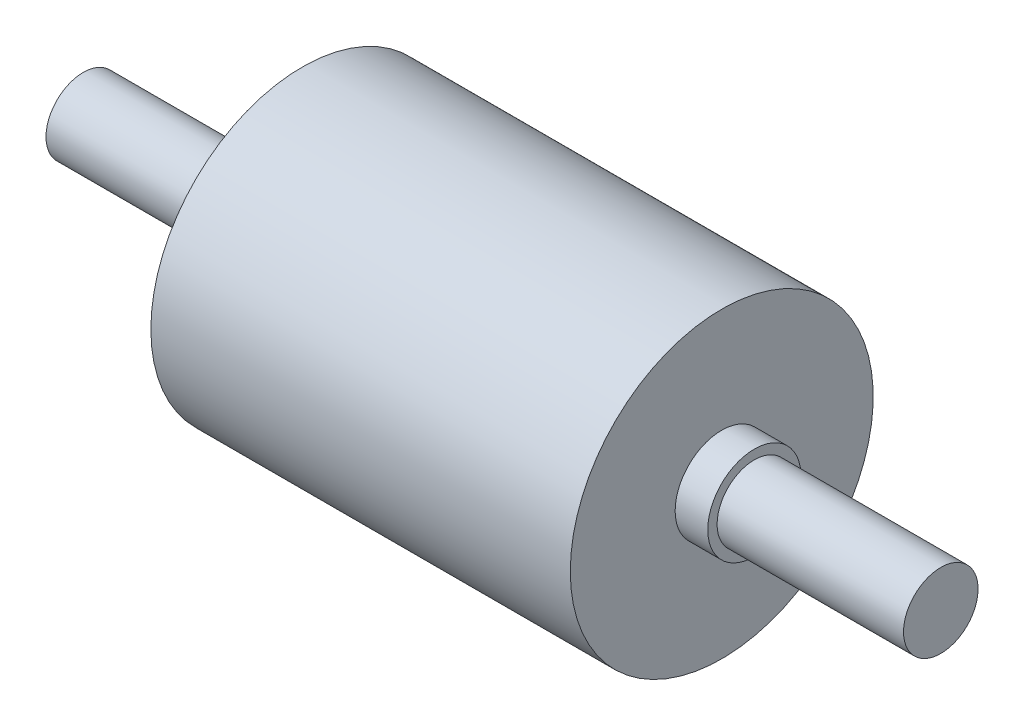
from build123d import *


with BuildPart() as part:
    # Çizim1 → Döndür1 (revolve)
    with BuildSketch(Plane.XY):
        Polygon((0, 0), (0, 4), (20, 4), (20, 5), (23.5, 5), (23.5, 16.25), (68.5, 16.25), (68.5, 5), (72, 5), (72, 4), (92, 4), (92, 0), align=None)
    revolve(axis=Axis((0, 0, 0), (1, 0, 0)))


solid = part.part
